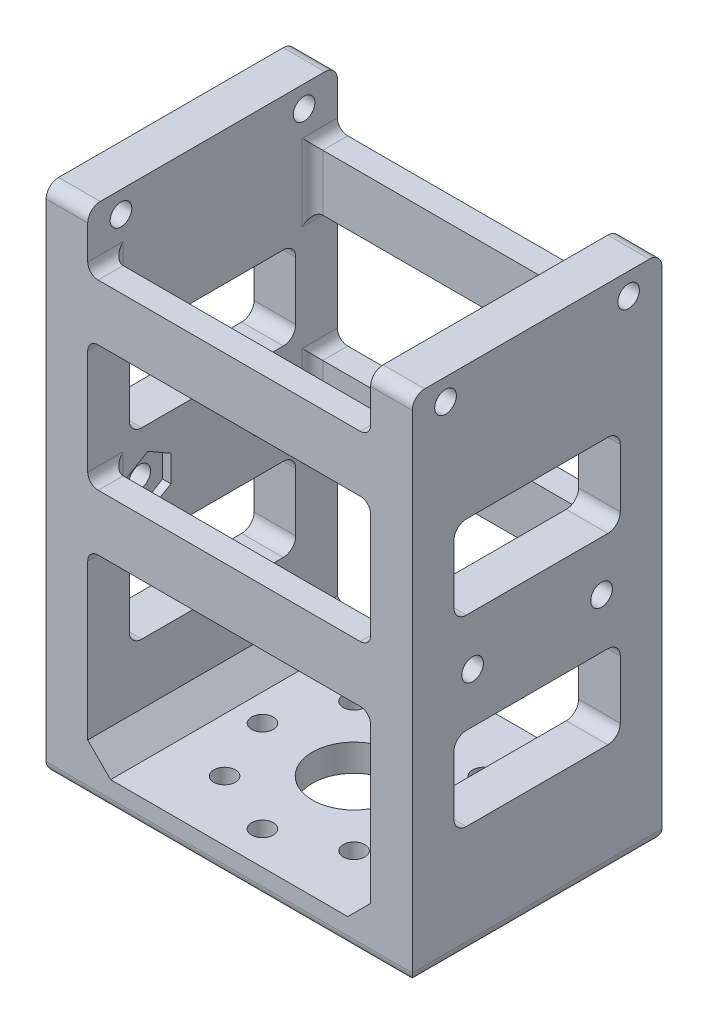
from build123d import *

# Parameters (mm, degrees)
SKETCH1_W            = 44
SKETCH1_H            = 30
BOSS_EXTRUDE1_DEPTH  = 54.5
SKETCH5_W            = 5
SKETCH5_H            = 30
BOSS_EXTRUDE3_DEPTH  = 6.8
SKETCH9_R            = 1.3
CUT_EXTRUDE6_DEPTH   = 79.604643629
FILLET1_R            = 1.5
FILLET2_R            = 1.25
SKETCH11_W           = 34
SKETCH11_H           = 24
CUT_EXTRUDE7_DEPTH   = 51.25
SKETCH13_R           = 5
SKETCH13_R_2         = 1.3
CUT_EXTRUDE8_DEPTH   = 3.5
CIRPATTERN1_COUNT    = 8
CUT_EXTRUDE10_REACH  = 83.202
SKETCH15_W           = 20
SKETCH15_H           = 10
FILLET6_R            = 1.5
FILLET6_OF_MIRROR4_R = 1.5
CUT_EXTRUDE11_REACH  = 83.202
SKETCH16_W           = 34
SKETCH16_H           = 15.125
SKETCH16_H_2         = 22.625
FILLET7_R            = 1.25
CHAMFER1_SIZE        = 2.75
SKETCH18_R           = 1.3
CUT_EXTRUDE12_DEPTH  = 5
CUT_EXTRUDE13_DEPTH  = 1


with BuildPart() as part:
    # Sketch1 → Boss-Extrude1 (new body)
    with BuildSketch(Plane(origin=(0, 0, 0), x_dir=(1, 0, 0), z_dir=(0, 1, 0))):
        with Locations((22, 15)):
            Rectangle(SKETCH1_W, SKETCH1_H)
    extrude(amount=BOSS_EXTRUDE1_DEPTH)

    # Sketch5 → Boss-Extrude3 (add)
    with BuildSketch(Plane(origin=(0, 54.5, 0), x_dir=(1, 0, 0), z_dir=(0, 1, 0))):
        with Locations((2.5, 15)):
            Rectangle(SKETCH5_W, SKETCH5_H)
    boss_extrude3 = extrude(amount=BOSS_EXTRUDE3_DEPTH)

    # Sketch9 → Cut-Extrude6 (cut, through all)
    with BuildSketch(Plane(origin=(5, 0, 0), x_dir=(0, 0, -1), z_dir=(1, 0, 0))):
        with Locations((26, 58.7)):
            Circle(SKETCH9_R)
        with Locations((4, 58.7)):
            Circle(SKETCH9_R)
    cut_extrude6 = extrude(amount=-CUT_EXTRUDE6_DEPTH, mode=Mode.SUBTRACT)

    # Mirror2: Boss-Extrude3, Cut-Extrude6 across plane
    add(boss_extrude3.mirror(Plane.ZY.offset(-22)))
    add(cut_extrude6.mirror(Plane.ZY.offset(-22)), mode=Mode.SUBTRACT)

    # Fillet1
    fillet1_edges = [part.edges().sort_by_distance(p)[0] for p in [
        (41.5, 61.3, -30),
        (2.5, 61.3, -30),
        (2.5, 61.3, 0),
        (41.5, 61.3, 0),
    ]]
    fillet(fillet1_edges, radius=FILLET1_R)

    # Fillet2
    fillet2_edges = [part.edges().sort_by_distance(p)[0] for p in [
        (0, 0, -15),
        (22, 0, -30),
        (22, 0, 0),
        (44, 0, -15),
    ]]
    fillet(fillet2_edges, radius=FILLET2_R)

    # Sketch11 → Cut-Extrude7 (cut)
    with BuildSketch(Plane(origin=(0, 54.5, 0), x_dir=(1, 0, 0), z_dir=(0, 1, 0))):
        with Locations((22, 15)):
            Rectangle(SKETCH11_W, SKETCH11_H)
    extrude(amount=-CUT_EXTRUDE7_DEPTH, mode=Mode.SUBTRACT)

    # Sketch13 → Cut-Extrude8 (cut)
    with BuildSketch(Plane.XZ):
        with Locations((22, -15)):
            Circle(SKETCH13_R)
        with Locations((33, -15)):
            Circle(SKETCH13_R_2)
    cut_extrude8 = extrude(amount=-CUT_EXTRUDE8_DEPTH, mode=Mode.SUBTRACT)

    # CirPattern1: Cut-Extrude8 ×8 about axis
    cirpattern1_axis = Axis((22, 0, -15), (0, -1, 0))
    for i in range(1, CIRPATTERN1_COUNT):
        add(cut_extrude8.rotate(cirpattern1_axis, i * 360 / CIRPATTERN1_COUNT), mode=Mode.SUBTRACT)

    # Sketch15 → Cut-Extrude10 (cut, up to next)
    with BuildSketch(Plane(origin=(44, 0, 0), x_dir=(0, 0, -1), z_dir=(1, 0, 0)), mode=Mode.PRIVATE) as cut_extrude10_sk1:
        with Locations((15, 18.25)):
            Rectangle(SKETCH15_W, SKETCH15_H)
    cut_extrude10_tool1 = extrude(cut_extrude10_sk1.sketch, amount=-CUT_EXTRUDE10_REACH, mode=Mode.PRIVATE) & part.part
    # Sketch15 → Cut-Extrude10 (cut, up to next)
    with BuildSketch(Plane(origin=(44, 0, 0), x_dir=(0, 0, -1), z_dir=(1, 0, 0)), mode=Mode.PRIVATE) as cut_extrude10_sk2:
        with Locations((15, 40.25)):
            Rectangle(SKETCH15_W, SKETCH15_H)
    cut_extrude10_tool2 = extrude(cut_extrude10_sk2.sketch, amount=-CUT_EXTRUDE10_REACH, mode=Mode.PRIVATE) & part.part
    cut_extrude10_1 = cut_extrude10_tool1.solids().sort_by_distance((44, 18.25, -15))[0]
    add(cut_extrude10_1, mode=Mode.SUBTRACT)
    cut_extrude10_2 = cut_extrude10_tool2.solids().sort_by_distance((44, 40.25, -15))[0]
    add(cut_extrude10_2, mode=Mode.SUBTRACT)
    cut_extrude10 = cut_extrude10_1 + cut_extrude10_2  # Cut-Extrude10 as one shape, for the pattern or mirror that repeats it

    # Fillet6
    fillet6_edges = [part.edges().sort_by_distance(p)[0] for p in [
        (41.5, 13.25, -5),
        (41.5, 35.25, -5),
        (41.5, 23.25, -5),
        (41.5, 45.25, -5),
        (41.5, 23.25, -25),
        (41.5, 45.25, -25),
        (41.5, 35.25, -25),
        (41.5, 13.25, -25),
    ]]
    fillet(fillet6_edges, radius=FILLET6_R)

    # Mirror4: Cut-Extrude10 across plane
    add(cut_extrude10.mirror(Plane.ZY.offset(-22)), mode=Mode.SUBTRACT)

    # Fillet6 of Mirror4
    fillet6_of_mirror4_edges = [part.edges().sort_by_distance(p)[0] for p in [
        (2.5, 13.25, -5),
        (2.5, 35.25, -5),
        (2.5, 23.25, -5),
        (2.5, 45.25, -5),
        (2.5, 23.25, -25),
        (2.5, 45.25, -25),
        (2.5, 35.25, -25),
        (2.5, 13.25, -25),
    ]]
    fillet(fillet6_of_mirror4_edges, radius=FILLET6_OF_MIRROR4_R)

    # Sketch16 → Cut-Extrude11 (cut, up to next)
    with BuildSketch(Plane.XY, mode=Mode.PRIVATE) as cut_extrude11_sk1:
        with Locations((22, 40.1875)):
            Rectangle(SKETCH16_W, SKETCH16_H)
    cut_extrude11_tool1 = extrude(cut_extrude11_sk1.sketch, amount=-CUT_EXTRUDE11_REACH, mode=Mode.PRIVATE) & part.part
    # Sketch16 → Cut-Extrude11 (cut, up to next)
    with BuildSketch(Plane.XY, mode=Mode.PRIVATE) as cut_extrude11_sk2:
        with Locations((22, 14.5625)):
            Rectangle(SKETCH16_W, SKETCH16_H_2)
    cut_extrude11_tool2 = extrude(cut_extrude11_sk2.sketch, amount=-CUT_EXTRUDE11_REACH, mode=Mode.PRIVATE) & part.part
    cut_extrude11_1 = cut_extrude11_tool1.solids().sort_by_distance((22, 40.1875, 0))[0]
    add(cut_extrude11_1, mode=Mode.SUBTRACT)
    cut_extrude11_2 = cut_extrude11_tool2.solids().sort_by_distance((22, 14.5625, 0))[0]
    add(cut_extrude11_2, mode=Mode.SUBTRACT)
    cut_extrude11 = cut_extrude11_1 + cut_extrude11_2  # Cut-Extrude11 as one shape, for the pattern or mirror that repeats it

    # Mirror5: Cut-Extrude11 across plane
    add(cut_extrude11.mirror(Plane(origin=(0, 0, -15), x_dir=(1, 0, 0), z_dir=(0, 0, -1))), mode=Mode.SUBTRACT)

    # Fillet7
    fillet7_edges = [part.edges().sort_by_distance(p)[0] for p in [
        (5, 47.75, -28.5),
        (5, 47.75, -1.5),
        (5, 54.5, -1.5),
        (5, 54.5, -28.5),
        (39, 54.5, -1.5),
        (39, 54.5, -28.5),
        (39, 47.75, -28.5),
        (39, 47.75, -1.5),
        (5, 29.25, -3),
        (39, 29.25, -3),
        (39, 51.125, -3),
        (5, 51.125, -3),
        (5, 51.125, -27),
        (39, 51.125, -27),
        (39, 29.25, -27),
        (5, 29.25, -27),
        (39, 25.875, -1.5),
        (39, 25.875, -28.5),
        (5, 25.875, -28.5),
        (5, 25.875, -1.5),
        (5, 32.625, -28.5),
        (39, 32.625, -28.5),
        (39, 32.625, -1.5),
        (5, 32.625, -1.5),
    ]]
    fillet(fillet7_edges, radius=FILLET7_R)

    # Chamfer1
    chamfer1_edges = [part.edges().sort_by_distance(p)[0] for p in [
        (5, 3.25, -15),
        (39, 3.25, -15),
    ]]
    chamfer(chamfer1_edges, length=CHAMFER1_SIZE)

    # Sketch18 → Cut-Extrude12 (cut)
    with BuildSketch(Plane.ZY):
        with Locations((-22.75, 29.25)):
            Circle(SKETCH18_R)
        with Locations((-7.25, 29.25)):
            Circle(SKETCH18_R)
    cut_extrude12 = extrude(amount=-CUT_EXTRUDE12_DEPTH, mode=Mode.SUBTRACT)

    # Sketch19 → Cut-Extrude13 (cut)
    with BuildSketch(Plane(origin=(5, 0, 0), x_dir=(0, 0, -1), z_dir=(1, 0, 0))):
        Polygon((7.25, 26.074573519), (10, 27.66228676), (10, 30.83771324), (7.25, 32.425426481), (4.5, 30.83771324), (4.5, 27.66228676), align=None)
        Polygon((22.75, 26.074573519), (25.5, 27.66228676), (25.5, 30.83771324), (22.75, 32.425426481), (20, 30.83771324), (20, 27.66228676), align=None)
    cut_extrude13 = extrude(amount=-CUT_EXTRUDE13_DEPTH, mode=Mode.SUBTRACT)

    # Mirror6: Cut-Extrude12, Cut-Extrude13 across plane
    add(cut_extrude12.mirror(Plane.ZY.offset(-22)), mode=Mode.SUBTRACT)
    add(cut_extrude13.mirror(Plane.ZY.offset(-22)), mode=Mode.SUBTRACT)


solid = part.part
